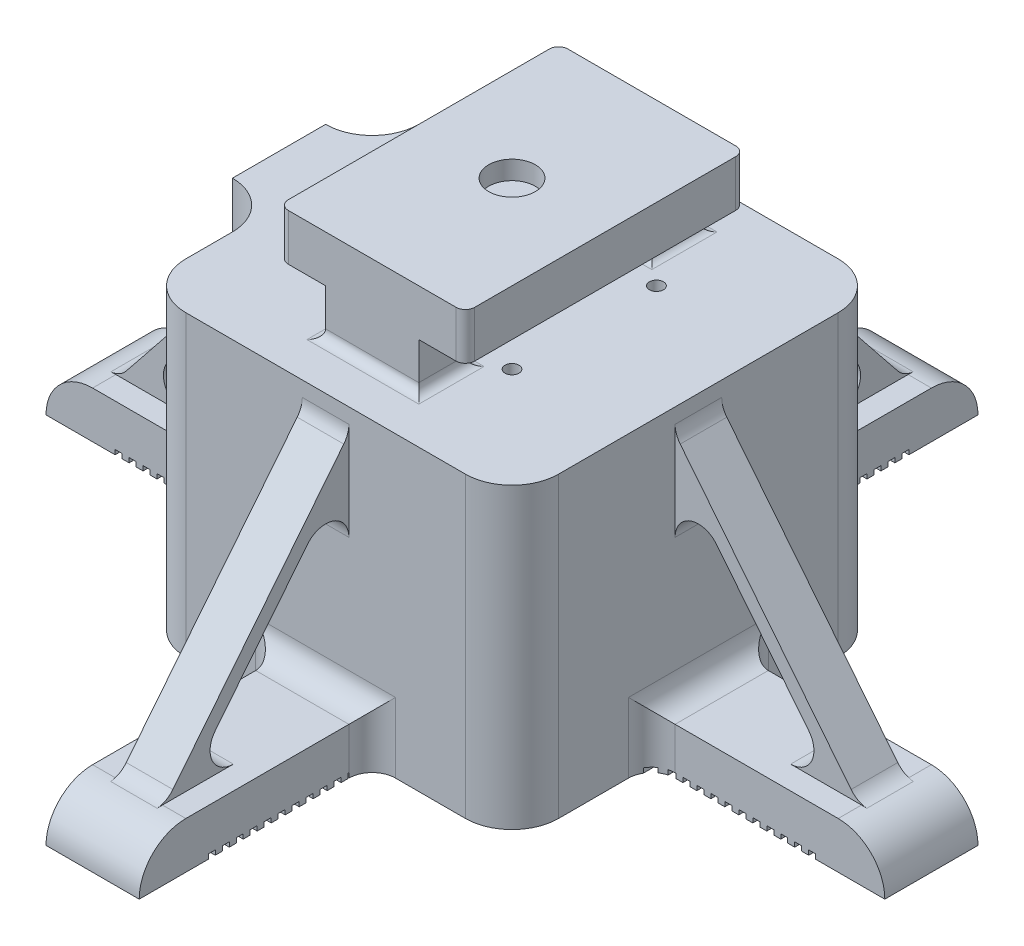
from build123d import *

# Parameters (mm, degrees)
SKETCH1_W                     = 80
SKETCH1_H                     = 80
BOSS_EXTRUDE1_DEPTH           = 14
SKETCH2_W                     = 80
SKETCH2_H                     = 80
SKETCH2_W_2                   = 70
SKETCH2_H_2                   = 70
BOSS_EXTRUDE2_DEPTH           = 50
SKETCH3_R                     = 1.5
CUT_EXTRUDE1_DEPTH            = 50
SKETCH4_R                     = 2.75
CUT_EXTRUDE2_DEPTH            = 50
SKETCH5_W                     = 20
SKETCH5_H                     = 10
BOSS_EXTRUDE3_DEPTH           = 50
SKETCH7_W                     = 45
SKETCH7_H                     = 10
CUT_EXTRUDE3_DEPTH            = 5
SKETCH8_W                     = 1.5
SKETCH8_H                     = 5
CUT_EXTRUDE4_DEPTH            = 1
LPATTERN1_COUNT               = 13
LPATTERN1_PITCH               = 3
LPATTERN1_COUNT_DIR2          = 2
LPATTERN1_PITCH_DIR2          = 15
CIRPATTERN10_COUNT            = 4
FILLET3_R                     = 5
CIRPATTERN11_COUNT            = 4
CIRPATTERN11_COPY_1_SKETCH_W  = 1.5
CIRPATTERN11_COPY_1_SKETCH_H  = 5
CIRPATTERN11_COPY_1_DEPTH     = 1
CIRPATTERN11_COPY_2_SKETCH_W  = 1.5
CIRPATTERN11_COPY_2_SKETCH_H  = 5
CIRPATTERN11_COPY_2_DEPTH     = 1
CIRPATTERN11_COPY_3_SKETCH_W  = 1.5
CIRPATTERN11_COPY_3_SKETCH_H  = 5
CIRPATTERN11_COPY_3_DEPTH     = 1
CIRPATTERN11_COPY_4_SKETCH_W  = 1.5
CIRPATTERN11_COPY_4_SKETCH_H  = 5
CIRPATTERN11_COPY_4_DEPTH     = 1
CIRPATTERN11_COPY_5_SKETCH_W  = 1.5
CIRPATTERN11_COPY_5_SKETCH_H  = 5
CIRPATTERN11_COPY_5_DEPTH     = 1
CIRPATTERN11_COPY_6_SKETCH_W  = 1.5
CIRPATTERN11_COPY_6_SKETCH_H  = 5
CIRPATTERN11_COPY_6_DEPTH     = 1
CIRPATTERN11_COPY_7_SKETCH_W  = 1.5
CIRPATTERN11_COPY_7_SKETCH_H  = 5
CIRPATTERN11_COPY_7_DEPTH     = 1
CIRPATTERN11_COPY_8_SKETCH_W  = 1.5
CIRPATTERN11_COPY_8_SKETCH_H  = 5
CIRPATTERN11_COPY_8_DEPTH     = 1
CIRPATTERN11_COPY_9_SKETCH_W  = 1.5
CIRPATTERN11_COPY_9_SKETCH_H  = 5
CIRPATTERN11_COPY_9_DEPTH     = 1
CIRPATTERN11_COPY_10_SKETCH_W = 1.5
CIRPATTERN11_COPY_10_SKETCH_H = 5
CIRPATTERN11_COPY_10_DEPTH    = 1
CIRPATTERN11_COPY_11_SKETCH_W = 1.5
CIRPATTERN11_COPY_11_SKETCH_H = 5
CIRPATTERN11_COPY_11_DEPTH    = 1
CIRPATTERN11_COPY_12_SKETCH_W = 1.5
CIRPATTERN11_COPY_12_SKETCH_H = 5
CIRPATTERN11_COPY_12_DEPTH    = 1
CIRPATTERN11_COPY_13_SKETCH_W = 1.5
CIRPATTERN11_COPY_13_SKETCH_H = 5
CIRPATTERN11_COPY_13_DEPTH    = 1
CIRPATTERN11_COPY_14_SKETCH_W = 1.5
CIRPATTERN11_COPY_14_SKETCH_H = 5
CIRPATTERN11_COPY_14_DEPTH    = 1
CIRPATTERN11_COPY_15_SKETCH_W = 1.5
CIRPATTERN11_COPY_15_SKETCH_H = 5
CIRPATTERN11_COPY_15_DEPTH    = 1
CIRPATTERN11_COPY_16_SKETCH_W = 1.5
CIRPATTERN11_COPY_16_SKETCH_H = 5
CIRPATTERN11_COPY_16_DEPTH    = 1
CIRPATTERN11_COPY_17_SKETCH_W = 1.5
CIRPATTERN11_COPY_17_SKETCH_H = 5
CIRPATTERN11_COPY_17_DEPTH    = 1
CIRPATTERN11_COPY_18_SKETCH_W = 1.5
CIRPATTERN11_COPY_18_SKETCH_H = 5
CIRPATTERN11_COPY_18_DEPTH    = 1
CIRPATTERN11_COPY_19_SKETCH_W = 1.5
CIRPATTERN11_COPY_19_SKETCH_H = 5
CIRPATTERN11_COPY_19_DEPTH    = 1
CIRPATTERN11_COPY_20_SKETCH_W = 1.5
CIRPATTERN11_COPY_20_SKETCH_H = 5
CIRPATTERN11_COPY_20_DEPTH    = 1
CIRPATTERN11_COPY_21_SKETCH_W = 1.5
CIRPATTERN11_COPY_21_SKETCH_H = 5
CIRPATTERN11_COPY_21_DEPTH    = 1
CIRPATTERN11_COPY_22_SKETCH_W = 1.5
CIRPATTERN11_COPY_22_SKETCH_H = 5
CIRPATTERN11_COPY_22_DEPTH    = 1
CIRPATTERN11_COPY_23_SKETCH_W = 1.5
CIRPATTERN11_COPY_23_SKETCH_H = 5
CIRPATTERN11_COPY_23_DEPTH    = 1
CIRPATTERN11_COPY_24_SKETCH_W = 1.5
CIRPATTERN11_COPY_24_SKETCH_H = 5
CIRPATTERN11_COPY_24_DEPTH    = 1
CIRPATTERN11_COPY_25_SKETCH_W = 1.5
CIRPATTERN11_COPY_25_SKETCH_H = 5
CIRPATTERN11_COPY_25_DEPTH    = 1
CIRPATTERN11_COPY_26_SKETCH_W = 1.5
CIRPATTERN11_COPY_26_SKETCH_H = 5
CIRPATTERN11_COPY_26_DEPTH    = 1
CIRPATTERN11_COPY_27_SKETCH_W = 1.5
CIRPATTERN11_COPY_27_SKETCH_H = 5
CIRPATTERN11_COPY_27_DEPTH    = 1
CIRPATTERN11_COPY_28_SKETCH_W = 1.5
CIRPATTERN11_COPY_28_SKETCH_H = 5
CIRPATTERN11_COPY_28_DEPTH    = 1
CIRPATTERN11_COPY_29_SKETCH_W = 1.5
CIRPATTERN11_COPY_29_SKETCH_H = 5
CIRPATTERN11_COPY_29_DEPTH    = 1
CIRPATTERN11_COPY_30_SKETCH_W = 1.5
CIRPATTERN11_COPY_30_SKETCH_H = 5
CIRPATTERN11_COPY_30_DEPTH    = 1
CIRPATTERN11_COPY_31_SKETCH_W = 1.5
CIRPATTERN11_COPY_31_SKETCH_H = 5
CIRPATTERN11_COPY_31_DEPTH    = 1
CIRPATTERN11_COPY_32_SKETCH_W = 1.5
CIRPATTERN11_COPY_32_SKETCH_H = 5
CIRPATTERN11_COPY_32_DEPTH    = 1
CIRPATTERN11_COPY_33_SKETCH_W = 1.5
CIRPATTERN11_COPY_33_SKETCH_H = 5
CIRPATTERN11_COPY_33_DEPTH    = 1
CIRPATTERN11_COPY_34_SKETCH_W = 1.5
CIRPATTERN11_COPY_34_SKETCH_H = 5
CIRPATTERN11_COPY_34_DEPTH    = 1
CIRPATTERN11_COPY_35_SKETCH_W = 1.5
CIRPATTERN11_COPY_35_SKETCH_H = 5
CIRPATTERN11_COPY_35_DEPTH    = 1
CIRPATTERN11_COPY_36_SKETCH_W = 1.5
CIRPATTERN11_COPY_36_SKETCH_H = 5
CIRPATTERN11_COPY_36_DEPTH    = 1
CIRPATTERN11_COPY_37_SKETCH_W = 1.5
CIRPATTERN11_COPY_37_SKETCH_H = 5
CIRPATTERN11_COPY_37_DEPTH    = 1
CIRPATTERN11_COPY_38_SKETCH_W = 1.5
CIRPATTERN11_COPY_38_SKETCH_H = 5
CIRPATTERN11_COPY_38_DEPTH    = 1
CIRPATTERN11_COPY_39_SKETCH_W = 1.5
CIRPATTERN11_COPY_39_SKETCH_H = 5
CIRPATTERN11_COPY_39_DEPTH    = 1
CIRPATTERN11_COPY_40_SKETCH_W = 1.5
CIRPATTERN11_COPY_40_SKETCH_H = 5
CIRPATTERN11_COPY_40_DEPTH    = 1
CIRPATTERN11_COPY_41_SKETCH_W = 1.5
CIRPATTERN11_COPY_41_SKETCH_H = 5
CIRPATTERN11_COPY_41_DEPTH    = 1
CIRPATTERN11_COPY_42_SKETCH_W = 1.5
CIRPATTERN11_COPY_42_SKETCH_H = 5
CIRPATTERN11_COPY_42_DEPTH    = 1
CIRPATTERN11_COPY_43_SKETCH_W = 1.5
CIRPATTERN11_COPY_43_SKETCH_H = 5
CIRPATTERN11_COPY_43_DEPTH    = 1
CIRPATTERN11_COPY_44_SKETCH_W = 1.5
CIRPATTERN11_COPY_44_SKETCH_H = 5
CIRPATTERN11_COPY_44_DEPTH    = 1
CIRPATTERN11_COPY_45_SKETCH_W = 1.5
CIRPATTERN11_COPY_45_SKETCH_H = 5
CIRPATTERN11_COPY_45_DEPTH    = 1
CIRPATTERN11_COPY_46_SKETCH_W = 1.5
CIRPATTERN11_COPY_46_SKETCH_H = 5
CIRPATTERN11_COPY_46_DEPTH    = 1
CIRPATTERN11_COPY_47_SKETCH_W = 1.5
CIRPATTERN11_COPY_47_SKETCH_H = 5
CIRPATTERN11_COPY_47_DEPTH    = 1
CIRPATTERN11_COPY_48_SKETCH_W = 1.5
CIRPATTERN11_COPY_48_SKETCH_H = 5
CIRPATTERN11_COPY_48_DEPTH    = 1
CIRPATTERN11_COPY_49_SKETCH_W = 1.5
CIRPATTERN11_COPY_49_SKETCH_H = 5
CIRPATTERN11_COPY_49_DEPTH    = 1
CIRPATTERN11_COPY_50_SKETCH_W = 1.5
CIRPATTERN11_COPY_50_SKETCH_H = 5
CIRPATTERN11_COPY_50_DEPTH    = 1
CIRPATTERN11_COPY_51_SKETCH_W = 1.5
CIRPATTERN11_COPY_51_SKETCH_H = 5
CIRPATTERN11_COPY_51_DEPTH    = 1
CIRPATTERN11_COPY_52_SKETCH_W = 1.5
CIRPATTERN11_COPY_52_SKETCH_H = 5
CIRPATTERN11_COPY_52_DEPTH    = 1
CIRPATTERN11_COPY_53_SKETCH_W = 1.5
CIRPATTERN11_COPY_53_SKETCH_H = 5
CIRPATTERN11_COPY_53_DEPTH    = 1
CIRPATTERN11_COPY_54_SKETCH_W = 1.5
CIRPATTERN11_COPY_54_SKETCH_H = 5
CIRPATTERN11_COPY_54_DEPTH    = 1
CIRPATTERN11_COPY_55_SKETCH_W = 1.5
CIRPATTERN11_COPY_55_SKETCH_H = 5
CIRPATTERN11_COPY_55_DEPTH    = 1
CIRPATTERN11_COPY_56_SKETCH_W = 1.5
CIRPATTERN11_COPY_56_SKETCH_H = 5
CIRPATTERN11_COPY_56_DEPTH    = 1
CIRPATTERN11_COPY_57_SKETCH_W = 1.5
CIRPATTERN11_COPY_57_SKETCH_H = 5
CIRPATTERN11_COPY_57_DEPTH    = 1
CIRPATTERN11_COPY_58_SKETCH_W = 1.5
CIRPATTERN11_COPY_58_SKETCH_H = 5
CIRPATTERN11_COPY_58_DEPTH    = 1
CIRPATTERN11_COPY_59_SKETCH_W = 1.5
CIRPATTERN11_COPY_59_SKETCH_H = 5
CIRPATTERN11_COPY_59_DEPTH    = 1
CIRPATTERN11_COPY_60_SKETCH_W = 1.5
CIRPATTERN11_COPY_60_SKETCH_H = 5
CIRPATTERN11_COPY_60_DEPTH    = 1
CIRPATTERN11_COPY_61_SKETCH_W = 1.5
CIRPATTERN11_COPY_61_SKETCH_H = 5
CIRPATTERN11_COPY_61_DEPTH    = 1
CIRPATTERN11_COPY_62_SKETCH_W = 1.5
CIRPATTERN11_COPY_62_SKETCH_H = 5
CIRPATTERN11_COPY_62_DEPTH    = 1
CIRPATTERN11_COPY_63_SKETCH_W = 1.5
CIRPATTERN11_COPY_63_SKETCH_H = 5
CIRPATTERN11_COPY_63_DEPTH    = 1
CIRPATTERN11_COPY_64_SKETCH_W = 1.5
CIRPATTERN11_COPY_64_SKETCH_H = 5
CIRPATTERN11_COPY_64_DEPTH    = 1
CIRPATTERN11_COPY_65_SKETCH_W = 1.5
CIRPATTERN11_COPY_65_SKETCH_H = 5
CIRPATTERN11_COPY_65_DEPTH    = 1
CIRPATTERN11_COPY_66_SKETCH_W = 1.5
CIRPATTERN11_COPY_66_SKETCH_H = 5
CIRPATTERN11_COPY_66_DEPTH    = 1
CIRPATTERN11_COPY_67_SKETCH_W = 1.5
CIRPATTERN11_COPY_67_SKETCH_H = 5
CIRPATTERN11_COPY_67_DEPTH    = 1
CIRPATTERN11_COPY_68_SKETCH_W = 1.5
CIRPATTERN11_COPY_68_SKETCH_H = 5
CIRPATTERN11_COPY_68_DEPTH    = 1
CIRPATTERN11_COPY_69_SKETCH_W = 1.5
CIRPATTERN11_COPY_69_SKETCH_H = 5
CIRPATTERN11_COPY_69_DEPTH    = 1
CIRPATTERN11_COPY_70_SKETCH_W = 1.5
CIRPATTERN11_COPY_70_SKETCH_H = 5
CIRPATTERN11_COPY_70_DEPTH    = 1
CIRPATTERN11_COPY_71_SKETCH_W = 1.5
CIRPATTERN11_COPY_71_SKETCH_H = 5
CIRPATTERN11_COPY_71_DEPTH    = 1
CIRPATTERN11_COPY_72_SKETCH_W = 1.5
CIRPATTERN11_COPY_72_SKETCH_H = 5
CIRPATTERN11_COPY_72_DEPTH    = 1
CIRPATTERN11_COPY_73_SKETCH_W = 1.5
CIRPATTERN11_COPY_73_SKETCH_H = 5
CIRPATTERN11_COPY_73_DEPTH    = 1
CIRPATTERN11_COPY_74_SKETCH_W = 1.5
CIRPATTERN11_COPY_74_SKETCH_H = 5
CIRPATTERN11_COPY_74_DEPTH    = 1
CIRPATTERN11_COPY_75_SKETCH_W = 1.5
CIRPATTERN11_COPY_75_SKETCH_H = 5
CIRPATTERN11_COPY_75_DEPTH    = 1
FILLET4_R                     = 10
FILLET5_R                     = 10
BOSS_EXTRUDE4_DEPTH           = 5
CIRPATTERN13_COUNT            = 4
FILLET7_R                     = 5
SKETCH11_W                    = 20
SKETCH11_H                    = 25
BOSS_EXTRUDE5_DEPTH           = 10
FILLET8_R                     = 10
SKETCH10_R                    = 2.25
CUT_EXTRUDE5_DEPTH            = 5
SKETCH12_W                    = 20
SKETCH12_H                    = 10
BOSS_EXTRUDE6_DEPTH           = 10
SKETCH13_W                    = 40
SKETCH13_H                    = 60
BOSS_EXTRUDE7_DEPTH           = 10
SKETCH14_R                    = 5
CUT_EXTRUDE6_DEPTH            = 4
FILLET9_R                     = 2


# Some blends are built 0.0001 mm under size
with BuildPart() as part:
    # Sketch1 → Boss-Extrude1 (new body)
    with BuildSketch(Plane(origin=(0, 0, 0), x_dir=(1, 0, 0), z_dir=(0, 1, 0))):
        Rectangle(SKETCH1_W, SKETCH1_H)
    extrude(amount=BOSS_EXTRUDE1_DEPTH)

    # Sketch2 → Boss-Extrude2 (add)
    with BuildSketch(Plane.XZ):
        Rectangle(SKETCH2_W, SKETCH2_H)
        Rectangle(SKETCH2_W_2, SKETCH2_H_2, mode=Mode.SUBTRACT)
    extrude(amount=BOSS_EXTRUDE2_DEPTH)

    # Sketch3 → Cut-Extrude1 (cut)
    with BuildSketch(Plane.XZ):
        with Locations(Location((-15.5, 15.5, 0), (0, 0, 270))):
            Circle(SKETCH3_R)
        with Locations(Location((15.5, 15.5, 0), (0, 0, 270))):
            Circle(SKETCH3_R)
        with Locations(Location((15.5, -15.5, 0), (0, 0, 270))):
            Circle(SKETCH3_R)
        with Locations(Location((-15.5, -15.5, 0), (0, 0, 270))):
            Circle(SKETCH3_R)
    extrude(amount=-CUT_EXTRUDE1_DEPTH, mode=Mode.SUBTRACT)

    # Sketch4 → Cut-Extrude2 (cut)
    with BuildSketch(Plane.XZ):
        with Locations(Location((0, 0, 0), (0, 0, 270))):
            Circle(SKETCH4_R)
    extrude(amount=-CUT_EXTRUDE2_DEPTH, mode=Mode.SUBTRACT)

    # Sketch5 → Boss-Extrude3 (add)
    with BuildSketch(Plane(origin=(40, 0, 0), x_dir=(0, 0, -1), z_dir=(1, 0, 0))):
        with Locations((0, -45)):
            Rectangle(SKETCH5_W, SKETCH5_H)
    boss_extrude3 = extrude(amount=BOSS_EXTRUDE3_DEPTH)

    # Sketch7 → Cut-Extrude3 (cut)
    with BuildSketch(Plane.XZ.offset(50)):
        with Locations((62.5, 0)):
            Rectangle(SKETCH7_W, SKETCH7_H)
    extrude(amount=-CUT_EXTRUDE3_DEPTH, mode=Mode.SUBTRACT)

    # Sketch8 → Cut-Extrude4 (cut)
    with BuildSketch(Plane.XZ.offset(50)):
        with Locations((38.422115652, 7.5)):
            Rectangle(SKETCH8_W, SKETCH8_H)
    cut_extrude4 = extrude(amount=-CUT_EXTRUDE4_DEPTH, mode=Mode.SUBTRACT)

    # LPattern1: Cut-Extrude4 13 × 2
    with Locations(*[(i * LPATTERN1_PITCH, 0, -j * LPATTERN1_PITCH_DIR2) for i in range(LPATTERN1_COUNT) for j in range(LPATTERN1_COUNT_DIR2) if (i, j) != (0, 0)]):
        add(cut_extrude4, mode=Mode.SUBTRACT)

    # CirPattern10: Boss-Extrude3 ×4 about axis
    cirpattern10_axis = Axis((0, 0, 0), (0, 1, 0))
    for i in range(1, CIRPATTERN10_COUNT):
        add(boss_extrude3.rotate(cirpattern10_axis, i * 360 / CIRPATTERN10_COUNT))

    # Fillet3
    fillet3_edges = [part.edges().sort_by_distance(p)[0] for p in [
        (-10, -45, 40),
        (-40, -45, 10),
        (-40, -40, 0),
        (-40, -45, -10),
        (-10, -45, -40),
        (0, -40, -40),
        (10, -45, -40),
        (40, -45, -10),
        (40, -40, 0),
        (0, -40, 40),
        (40, -45, 10),
        (10, -45, 40),
    ]]
    fillet(fillet3_edges, radius=FILLET3_R)

    # CirPattern11: Cut-Extrude4 ×4 about axis
    cirpattern11_axis = Axis((0, 0, 0), (0, 1, 0))
    for i in range(1, CIRPATTERN11_COUNT):
        add(cut_extrude4.rotate(cirpattern11_axis, i * 360 / CIRPATTERN11_COUNT), mode=Mode.SUBTRACT)

    # CirPattern11 copy 1 sketch → CirPattern11 copy 1 (cut)
    with BuildSketch(Plane(origin=(-15, -50, 0), x_dir=(0, 0, -1), z_dir=(0, -1, 0))):
        with Locations((38.422115652, 7.5)):
            Rectangle(CIRPATTERN11_COPY_1_SKETCH_W, CIRPATTERN11_COPY_1_SKETCH_H)
    extrude(amount=-CIRPATTERN11_COPY_1_DEPTH, mode=Mode.SUBTRACT)

    # CirPattern11 copy 2 sketch → CirPattern11 copy 2 (cut)
    with BuildSketch(Plane(origin=(0, -50, 15), x_dir=(-1, 0, 0), z_dir=(0, -1, 0))):
        with Locations((38.422115652, 7.5)):
            Rectangle(CIRPATTERN11_COPY_2_SKETCH_W, CIRPATTERN11_COPY_2_SKETCH_H)
    extrude(amount=-CIRPATTERN11_COPY_2_DEPTH, mode=Mode.SUBTRACT)

    # CirPattern11 copy 3 sketch → CirPattern11 copy 3 (cut)
    with BuildSketch(Plane(origin=(15, -50, 0), x_dir=(0, 0, 1), z_dir=(0, -1, 0))):
        with Locations((38.422115652, 7.5)):
            Rectangle(CIRPATTERN11_COPY_3_SKETCH_W, CIRPATTERN11_COPY_3_SKETCH_H)
    extrude(amount=-CIRPATTERN11_COPY_3_DEPTH, mode=Mode.SUBTRACT)

    # CirPattern11 copy 4 sketch → CirPattern11 copy 4 (cut)
    with BuildSketch(Plane(origin=(0, -50, -3), x_dir=(0, 0, -1), z_dir=(0, -1, 0))):
        with Locations((38.422115652, 7.5)):
            Rectangle(CIRPATTERN11_COPY_4_SKETCH_W, CIRPATTERN11_COPY_4_SKETCH_H)
    extrude(amount=-CIRPATTERN11_COPY_4_DEPTH, mode=Mode.SUBTRACT)

    # CirPattern11 copy 5 sketch → CirPattern11 copy 5 (cut)
    with BuildSketch(Plane(origin=(-3, -50, 0), x_dir=(-1, 0, 0), z_dir=(0, -1, 0))):
        with Locations((38.422115652, 7.5)):
            Rectangle(CIRPATTERN11_COPY_5_SKETCH_W, CIRPATTERN11_COPY_5_SKETCH_H)
    extrude(amount=-CIRPATTERN11_COPY_5_DEPTH, mode=Mode.SUBTRACT)

    # CirPattern11 copy 6 sketch → CirPattern11 copy 6 (cut)
    with BuildSketch(Plane(origin=(0, -50, 3), x_dir=(0, 0, 1), z_dir=(0, -1, 0))):
        with Locations((38.422115652, 7.5)):
            Rectangle(CIRPATTERN11_COPY_6_SKETCH_W, CIRPATTERN11_COPY_6_SKETCH_H)
    extrude(amount=-CIRPATTERN11_COPY_6_DEPTH, mode=Mode.SUBTRACT)

    # CirPattern11 copy 7 sketch → CirPattern11 copy 7 (cut)
    with BuildSketch(Plane(origin=(-15, -50, -3), x_dir=(0, 0, -1), z_dir=(0, -1, 0))):
        with Locations((38.422115652, 7.5)):
            Rectangle(CIRPATTERN11_COPY_7_SKETCH_W, CIRPATTERN11_COPY_7_SKETCH_H)
    extrude(amount=-CIRPATTERN11_COPY_7_DEPTH, mode=Mode.SUBTRACT)

    # CirPattern11 copy 8 sketch → CirPattern11 copy 8 (cut)
    with BuildSketch(Plane(origin=(-3, -50, 15), x_dir=(-1, 0, 0), z_dir=(0, -1, 0))):
        with Locations((38.422115652, 7.5)):
            Rectangle(CIRPATTERN11_COPY_8_SKETCH_W, CIRPATTERN11_COPY_8_SKETCH_H)
    extrude(amount=-CIRPATTERN11_COPY_8_DEPTH, mode=Mode.SUBTRACT)

    # CirPattern11 copy 9 sketch → CirPattern11 copy 9 (cut)
    with BuildSketch(Plane(origin=(15, -50, 3), x_dir=(0, 0, 1), z_dir=(0, -1, 0))):
        with Locations((38.422115652, 7.5)):
            Rectangle(CIRPATTERN11_COPY_9_SKETCH_W, CIRPATTERN11_COPY_9_SKETCH_H)
    extrude(amount=-CIRPATTERN11_COPY_9_DEPTH, mode=Mode.SUBTRACT)

    # CirPattern11 copy 10 sketch → CirPattern11 copy 10 (cut)
    with BuildSketch(Plane(origin=(0, -50, -6), x_dir=(0, 0, -1), z_dir=(0, -1, 0))):
        with Locations((38.422115652, 7.5)):
            Rectangle(CIRPATTERN11_COPY_10_SKETCH_W, CIRPATTERN11_COPY_10_SKETCH_H)
    extrude(amount=-CIRPATTERN11_COPY_10_DEPTH, mode=Mode.SUBTRACT)

    # CirPattern11 copy 11 sketch → CirPattern11 copy 11 (cut)
    with BuildSketch(Plane(origin=(-6, -50, 0), x_dir=(-1, 0, 0), z_dir=(0, -1, 0))):
        with Locations((38.422115652, 7.5)):
            Rectangle(CIRPATTERN11_COPY_11_SKETCH_W, CIRPATTERN11_COPY_11_SKETCH_H)
    extrude(amount=-CIRPATTERN11_COPY_11_DEPTH, mode=Mode.SUBTRACT)

    # CirPattern11 copy 12 sketch → CirPattern11 copy 12 (cut)
    with BuildSketch(Plane(origin=(0, -50, 6), x_dir=(0, 0, 1), z_dir=(0, -1, 0))):
        with Locations((38.422115652, 7.5)):
            Rectangle(CIRPATTERN11_COPY_12_SKETCH_W, CIRPATTERN11_COPY_12_SKETCH_H)
    extrude(amount=-CIRPATTERN11_COPY_12_DEPTH, mode=Mode.SUBTRACT)

    # CirPattern11 copy 13 sketch → CirPattern11 copy 13 (cut)
    with BuildSketch(Plane(origin=(-15, -50, -6), x_dir=(0, 0, -1), z_dir=(0, -1, 0))):
        with Locations((38.422115652, 7.5)):
            Rectangle(CIRPATTERN11_COPY_13_SKETCH_W, CIRPATTERN11_COPY_13_SKETCH_H)
    extrude(amount=-CIRPATTERN11_COPY_13_DEPTH, mode=Mode.SUBTRACT)

    # CirPattern11 copy 14 sketch → CirPattern11 copy 14 (cut)
    with BuildSketch(Plane(origin=(-6, -50, 15), x_dir=(-1, 0, 0), z_dir=(0, -1, 0))):
        with Locations((38.422115652, 7.5)):
            Rectangle(CIRPATTERN11_COPY_14_SKETCH_W, CIRPATTERN11_COPY_14_SKETCH_H)
    extrude(amount=-CIRPATTERN11_COPY_14_DEPTH, mode=Mode.SUBTRACT)

    # CirPattern11 copy 15 sketch → CirPattern11 copy 15 (cut)
    with BuildSketch(Plane(origin=(15, -50, 6), x_dir=(0, 0, 1), z_dir=(0, -1, 0))):
        with Locations((38.422115652, 7.5)):
            Rectangle(CIRPATTERN11_COPY_15_SKETCH_W, CIRPATTERN11_COPY_15_SKETCH_H)
    extrude(amount=-CIRPATTERN11_COPY_15_DEPTH, mode=Mode.SUBTRACT)

    # CirPattern11 copy 16 sketch → CirPattern11 copy 16 (cut)
    with BuildSketch(Plane(origin=(0, -50, -9), x_dir=(0, 0, -1), z_dir=(0, -1, 0))):
        with Locations((38.422115652, 7.5)):
            Rectangle(CIRPATTERN11_COPY_16_SKETCH_W, CIRPATTERN11_COPY_16_SKETCH_H)
    extrude(amount=-CIRPATTERN11_COPY_16_DEPTH, mode=Mode.SUBTRACT)

    # CirPattern11 copy 17 sketch → CirPattern11 copy 17 (cut)
    with BuildSketch(Plane(origin=(-9, -50, 0), x_dir=(-1, 0, 0), z_dir=(0, -1, 0))):
        with Locations((38.422115652, 7.5)):
            Rectangle(CIRPATTERN11_COPY_17_SKETCH_W, CIRPATTERN11_COPY_17_SKETCH_H)
    extrude(amount=-CIRPATTERN11_COPY_17_DEPTH, mode=Mode.SUBTRACT)

    # CirPattern11 copy 18 sketch → CirPattern11 copy 18 (cut)
    with BuildSketch(Plane(origin=(0, -50, 9), x_dir=(0, 0, 1), z_dir=(0, -1, 0))):
        with Locations((38.422115652, 7.5)):
            Rectangle(CIRPATTERN11_COPY_18_SKETCH_W, CIRPATTERN11_COPY_18_SKETCH_H)
    extrude(amount=-CIRPATTERN11_COPY_18_DEPTH, mode=Mode.SUBTRACT)

    # CirPattern11 copy 19 sketch → CirPattern11 copy 19 (cut)
    with BuildSketch(Plane(origin=(-15, -50, -9), x_dir=(0, 0, -1), z_dir=(0, -1, 0))):
        with Locations((38.422115652, 7.5)):
            Rectangle(CIRPATTERN11_COPY_19_SKETCH_W, CIRPATTERN11_COPY_19_SKETCH_H)
    extrude(amount=-CIRPATTERN11_COPY_19_DEPTH, mode=Mode.SUBTRACT)

    # CirPattern11 copy 20 sketch → CirPattern11 copy 20 (cut)
    with BuildSketch(Plane(origin=(-9, -50, 15), x_dir=(-1, 0, 0), z_dir=(0, -1, 0))):
        with Locations((38.422115652, 7.5)):
            Rectangle(CIRPATTERN11_COPY_20_SKETCH_W, CIRPATTERN11_COPY_20_SKETCH_H)
    extrude(amount=-CIRPATTERN11_COPY_20_DEPTH, mode=Mode.SUBTRACT)

    # CirPattern11 copy 21 sketch → CirPattern11 copy 21 (cut)
    with BuildSketch(Plane(origin=(15, -50, 9), x_dir=(0, 0, 1), z_dir=(0, -1, 0))):
        with Locations((38.422115652, 7.5)):
            Rectangle(CIRPATTERN11_COPY_21_SKETCH_W, CIRPATTERN11_COPY_21_SKETCH_H)
    extrude(amount=-CIRPATTERN11_COPY_21_DEPTH, mode=Mode.SUBTRACT)

    # CirPattern11 copy 22 sketch → CirPattern11 copy 22 (cut)
    with BuildSketch(Plane(origin=(0, -50, -12), x_dir=(0, 0, -1), z_dir=(0, -1, 0))):
        with Locations((38.422115652, 7.5)):
            Rectangle(CIRPATTERN11_COPY_22_SKETCH_W, CIRPATTERN11_COPY_22_SKETCH_H)
    extrude(amount=-CIRPATTERN11_COPY_22_DEPTH, mode=Mode.SUBTRACT)

    # CirPattern11 copy 23 sketch → CirPattern11 copy 23 (cut)
    with BuildSketch(Plane(origin=(-12, -50, 0), x_dir=(-1, 0, 0), z_dir=(0, -1, 0))):
        with Locations((38.422115652, 7.5)):
            Rectangle(CIRPATTERN11_COPY_23_SKETCH_W, CIRPATTERN11_COPY_23_SKETCH_H)
    extrude(amount=-CIRPATTERN11_COPY_23_DEPTH, mode=Mode.SUBTRACT)

    # CirPattern11 copy 24 sketch → CirPattern11 copy 24 (cut)
    with BuildSketch(Plane(origin=(0, -50, 12), x_dir=(0, 0, 1), z_dir=(0, -1, 0))):
        with Locations((38.422115652, 7.5)):
            Rectangle(CIRPATTERN11_COPY_24_SKETCH_W, CIRPATTERN11_COPY_24_SKETCH_H)
    extrude(amount=-CIRPATTERN11_COPY_24_DEPTH, mode=Mode.SUBTRACT)

    # CirPattern11 copy 25 sketch → CirPattern11 copy 25 (cut)
    with BuildSketch(Plane(origin=(-15, -50, -12), x_dir=(0, 0, -1), z_dir=(0, -1, 0))):
        with Locations((38.422115652, 7.5)):
            Rectangle(CIRPATTERN11_COPY_25_SKETCH_W, CIRPATTERN11_COPY_25_SKETCH_H)
    extrude(amount=-CIRPATTERN11_COPY_25_DEPTH, mode=Mode.SUBTRACT)

    # CirPattern11 copy 26 sketch → CirPattern11 copy 26 (cut)
    with BuildSketch(Plane(origin=(-12, -50, 15), x_dir=(-1, 0, 0), z_dir=(0, -1, 0))):
        with Locations((38.422115652, 7.5)):
            Rectangle(CIRPATTERN11_COPY_26_SKETCH_W, CIRPATTERN11_COPY_26_SKETCH_H)
    extrude(amount=-CIRPATTERN11_COPY_26_DEPTH, mode=Mode.SUBTRACT)

    # CirPattern11 copy 27 sketch → CirPattern11 copy 27 (cut)
    with BuildSketch(Plane(origin=(15, -50, 12), x_dir=(0, 0, 1), z_dir=(0, -1, 0))):
        with Locations((38.422115652, 7.5)):
            Rectangle(CIRPATTERN11_COPY_27_SKETCH_W, CIRPATTERN11_COPY_27_SKETCH_H)
    extrude(amount=-CIRPATTERN11_COPY_27_DEPTH, mode=Mode.SUBTRACT)

    # CirPattern11 copy 28 sketch → CirPattern11 copy 28 (cut)
    with BuildSketch(Plane(origin=(0, -50, -15), x_dir=(0, 0, -1), z_dir=(0, -1, 0))):
        with Locations((38.422115652, 7.5)):
            Rectangle(CIRPATTERN11_COPY_28_SKETCH_W, CIRPATTERN11_COPY_28_SKETCH_H)
    extrude(amount=-CIRPATTERN11_COPY_28_DEPTH, mode=Mode.SUBTRACT)

    # CirPattern11 copy 29 sketch → CirPattern11 copy 29 (cut)
    with BuildSketch(Plane(origin=(-15, -50, 0), x_dir=(-1, 0, 0), z_dir=(0, -1, 0))):
        with Locations((38.422115652, 7.5)):
            Rectangle(CIRPATTERN11_COPY_29_SKETCH_W, CIRPATTERN11_COPY_29_SKETCH_H)
    extrude(amount=-CIRPATTERN11_COPY_29_DEPTH, mode=Mode.SUBTRACT)

    # CirPattern11 copy 30 sketch → CirPattern11 copy 30 (cut)
    with BuildSketch(Plane(origin=(0, -50, 15), x_dir=(0, 0, 1), z_dir=(0, -1, 0))):
        with Locations((38.422115652, 7.5)):
            Rectangle(CIRPATTERN11_COPY_30_SKETCH_W, CIRPATTERN11_COPY_30_SKETCH_H)
    extrude(amount=-CIRPATTERN11_COPY_30_DEPTH, mode=Mode.SUBTRACT)

    # CirPattern11 copy 31 sketch → CirPattern11 copy 31 (cut)
    with BuildSketch(Plane(origin=(-15, -50, -15), x_dir=(0, 0, -1), z_dir=(0, -1, 0))):
        with Locations((38.422115652, 7.5)):
            Rectangle(CIRPATTERN11_COPY_31_SKETCH_W, CIRPATTERN11_COPY_31_SKETCH_H)
    extrude(amount=-CIRPATTERN11_COPY_31_DEPTH, mode=Mode.SUBTRACT)

    # CirPattern11 copy 32 sketch → CirPattern11 copy 32 (cut)
    with BuildSketch(Plane(origin=(-15, -50, 15), x_dir=(-1, 0, 0), z_dir=(0, -1, 0))):
        with Locations((38.422115652, 7.5)):
            Rectangle(CIRPATTERN11_COPY_32_SKETCH_W, CIRPATTERN11_COPY_32_SKETCH_H)
    extrude(amount=-CIRPATTERN11_COPY_32_DEPTH, mode=Mode.SUBTRACT)

    # CirPattern11 copy 33 sketch → CirPattern11 copy 33 (cut)
    with BuildSketch(Plane(origin=(15, -50, 15), x_dir=(0, 0, 1), z_dir=(0, -1, 0))):
        with Locations((38.422115652, 7.5)):
            Rectangle(CIRPATTERN11_COPY_33_SKETCH_W, CIRPATTERN11_COPY_33_SKETCH_H)
    extrude(amount=-CIRPATTERN11_COPY_33_DEPTH, mode=Mode.SUBTRACT)

    # CirPattern11 copy 34 sketch → CirPattern11 copy 34 (cut)
    with BuildSketch(Plane(origin=(0, -50, -18), x_dir=(0, 0, -1), z_dir=(0, -1, 0))):
        with Locations((38.422115652, 7.5)):
            Rectangle(CIRPATTERN11_COPY_34_SKETCH_W, CIRPATTERN11_COPY_34_SKETCH_H)
    extrude(amount=-CIRPATTERN11_COPY_34_DEPTH, mode=Mode.SUBTRACT)

    # CirPattern11 copy 35 sketch → CirPattern11 copy 35 (cut)
    with BuildSketch(Plane(origin=(-18, -50, 0), x_dir=(-1, 0, 0), z_dir=(0, -1, 0))):
        with Locations((38.422115652, 7.5)):
            Rectangle(CIRPATTERN11_COPY_35_SKETCH_W, CIRPATTERN11_COPY_35_SKETCH_H)
    extrude(amount=-CIRPATTERN11_COPY_35_DEPTH, mode=Mode.SUBTRACT)

    # CirPattern11 copy 36 sketch → CirPattern11 copy 36 (cut)
    with BuildSketch(Plane(origin=(0, -50, 18), x_dir=(0, 0, 1), z_dir=(0, -1, 0))):
        with Locations((38.422115652, 7.5)):
            Rectangle(CIRPATTERN11_COPY_36_SKETCH_W, CIRPATTERN11_COPY_36_SKETCH_H)
    extrude(amount=-CIRPATTERN11_COPY_36_DEPTH, mode=Mode.SUBTRACT)

    # CirPattern11 copy 37 sketch → CirPattern11 copy 37 (cut)
    with BuildSketch(Plane(origin=(-15, -50, -18), x_dir=(0, 0, -1), z_dir=(0, -1, 0))):
        with Locations((38.422115652, 7.5)):
            Rectangle(CIRPATTERN11_COPY_37_SKETCH_W, CIRPATTERN11_COPY_37_SKETCH_H)
    extrude(amount=-CIRPATTERN11_COPY_37_DEPTH, mode=Mode.SUBTRACT)

    # CirPattern11 copy 38 sketch → CirPattern11 copy 38 (cut)
    with BuildSketch(Plane(origin=(-18, -50, 15), x_dir=(-1, 0, 0), z_dir=(0, -1, 0))):
        with Locations((38.422115652, 7.5)):
            Rectangle(CIRPATTERN11_COPY_38_SKETCH_W, CIRPATTERN11_COPY_38_SKETCH_H)
    extrude(amount=-CIRPATTERN11_COPY_38_DEPTH, mode=Mode.SUBTRACT)

    # CirPattern11 copy 39 sketch → CirPattern11 copy 39 (cut)
    with BuildSketch(Plane(origin=(15, -50, 18), x_dir=(0, 0, 1), z_dir=(0, -1, 0))):
        with Locations((38.422115652, 7.5)):
            Rectangle(CIRPATTERN11_COPY_39_SKETCH_W, CIRPATTERN11_COPY_39_SKETCH_H)
    extrude(amount=-CIRPATTERN11_COPY_39_DEPTH, mode=Mode.SUBTRACT)

    # CirPattern11 copy 40 sketch → CirPattern11 copy 40 (cut)
    with BuildSketch(Plane(origin=(0, -50, -21), x_dir=(0, 0, -1), z_dir=(0, -1, 0))):
        with Locations((38.422115652, 7.5)):
            Rectangle(CIRPATTERN11_COPY_40_SKETCH_W, CIRPATTERN11_COPY_40_SKETCH_H)
    extrude(amount=-CIRPATTERN11_COPY_40_DEPTH, mode=Mode.SUBTRACT)

    # CirPattern11 copy 41 sketch → CirPattern11 copy 41 (cut)
    with BuildSketch(Plane(origin=(-21, -50, 0), x_dir=(-1, 0, 0), z_dir=(0, -1, 0))):
        with Locations((38.422115652, 7.5)):
            Rectangle(CIRPATTERN11_COPY_41_SKETCH_W, CIRPATTERN11_COPY_41_SKETCH_H)
    extrude(amount=-CIRPATTERN11_COPY_41_DEPTH, mode=Mode.SUBTRACT)

    # CirPattern11 copy 42 sketch → CirPattern11 copy 42 (cut)
    with BuildSketch(Plane(origin=(0, -50, 21), x_dir=(0, 0, 1), z_dir=(0, -1, 0))):
        with Locations((38.422115652, 7.5)):
            Rectangle(CIRPATTERN11_COPY_42_SKETCH_W, CIRPATTERN11_COPY_42_SKETCH_H)
    extrude(amount=-CIRPATTERN11_COPY_42_DEPTH, mode=Mode.SUBTRACT)

    # CirPattern11 copy 43 sketch → CirPattern11 copy 43 (cut)
    with BuildSketch(Plane(origin=(-15, -50, -21), x_dir=(0, 0, -1), z_dir=(0, -1, 0))):
        with Locations((38.422115652, 7.5)):
            Rectangle(CIRPATTERN11_COPY_43_SKETCH_W, CIRPATTERN11_COPY_43_SKETCH_H)
    extrude(amount=-CIRPATTERN11_COPY_43_DEPTH, mode=Mode.SUBTRACT)

    # CirPattern11 copy 44 sketch → CirPattern11 copy 44 (cut)
    with BuildSketch(Plane(origin=(-21, -50, 15), x_dir=(-1, 0, 0), z_dir=(0, -1, 0))):
        with Locations((38.422115652, 7.5)):
            Rectangle(CIRPATTERN11_COPY_44_SKETCH_W, CIRPATTERN11_COPY_44_SKETCH_H)
    extrude(amount=-CIRPATTERN11_COPY_44_DEPTH, mode=Mode.SUBTRACT)

    # CirPattern11 copy 45 sketch → CirPattern11 copy 45 (cut)
    with BuildSketch(Plane(origin=(15, -50, 21), x_dir=(0, 0, 1), z_dir=(0, -1, 0))):
        with Locations((38.422115652, 7.5)):
            Rectangle(CIRPATTERN11_COPY_45_SKETCH_W, CIRPATTERN11_COPY_45_SKETCH_H)
    extrude(amount=-CIRPATTERN11_COPY_45_DEPTH, mode=Mode.SUBTRACT)

    # CirPattern11 copy 46 sketch → CirPattern11 copy 46 (cut)
    with BuildSketch(Plane(origin=(0, -50, -24), x_dir=(0, 0, -1), z_dir=(0, -1, 0))):
        with Locations((38.422115652, 7.5)):
            Rectangle(CIRPATTERN11_COPY_46_SKETCH_W, CIRPATTERN11_COPY_46_SKETCH_H)
    extrude(amount=-CIRPATTERN11_COPY_46_DEPTH, mode=Mode.SUBTRACT)

    # CirPattern11 copy 47 sketch → CirPattern11 copy 47 (cut)
    with BuildSketch(Plane(origin=(-24, -50, 0), x_dir=(-1, 0, 0), z_dir=(0, -1, 0))):
        with Locations((38.422115652, 7.5)):
            Rectangle(CIRPATTERN11_COPY_47_SKETCH_W, CIRPATTERN11_COPY_47_SKETCH_H)
    extrude(amount=-CIRPATTERN11_COPY_47_DEPTH, mode=Mode.SUBTRACT)

    # CirPattern11 copy 48 sketch → CirPattern11 copy 48 (cut)
    with BuildSketch(Plane(origin=(0, -50, 24), x_dir=(0, 0, 1), z_dir=(0, -1, 0))):
        with Locations((38.422115652, 7.5)):
            Rectangle(CIRPATTERN11_COPY_48_SKETCH_W, CIRPATTERN11_COPY_48_SKETCH_H)
    extrude(amount=-CIRPATTERN11_COPY_48_DEPTH, mode=Mode.SUBTRACT)

    # CirPattern11 copy 49 sketch → CirPattern11 copy 49 (cut)
    with BuildSketch(Plane(origin=(-15, -50, -24), x_dir=(0, 0, -1), z_dir=(0, -1, 0))):
        with Locations((38.422115652, 7.5)):
            Rectangle(CIRPATTERN11_COPY_49_SKETCH_W, CIRPATTERN11_COPY_49_SKETCH_H)
    extrude(amount=-CIRPATTERN11_COPY_49_DEPTH, mode=Mode.SUBTRACT)

    # CirPattern11 copy 50 sketch → CirPattern11 copy 50 (cut)
    with BuildSketch(Plane(origin=(-24, -50, 15), x_dir=(-1, 0, 0), z_dir=(0, -1, 0))):
        with Locations((38.422115652, 7.5)):
            Rectangle(CIRPATTERN11_COPY_50_SKETCH_W, CIRPATTERN11_COPY_50_SKETCH_H)
    extrude(amount=-CIRPATTERN11_COPY_50_DEPTH, mode=Mode.SUBTRACT)

    # CirPattern11 copy 51 sketch → CirPattern11 copy 51 (cut)
    with BuildSketch(Plane(origin=(15, -50, 24), x_dir=(0, 0, 1), z_dir=(0, -1, 0))):
        with Locations((38.422115652, 7.5)):
            Rectangle(CIRPATTERN11_COPY_51_SKETCH_W, CIRPATTERN11_COPY_51_SKETCH_H)
    extrude(amount=-CIRPATTERN11_COPY_51_DEPTH, mode=Mode.SUBTRACT)

    # CirPattern11 copy 52 sketch → CirPattern11 copy 52 (cut)
    with BuildSketch(Plane(origin=(0, -50, -27), x_dir=(0, 0, -1), z_dir=(0, -1, 0))):
        with Locations((38.422115652, 7.5)):
            Rectangle(CIRPATTERN11_COPY_52_SKETCH_W, CIRPATTERN11_COPY_52_SKETCH_H)
    extrude(amount=-CIRPATTERN11_COPY_52_DEPTH, mode=Mode.SUBTRACT)

    # CirPattern11 copy 53 sketch → CirPattern11 copy 53 (cut)
    with BuildSketch(Plane(origin=(-27, -50, 0), x_dir=(-1, 0, 0), z_dir=(0, -1, 0))):
        with Locations((38.422115652, 7.5)):
            Rectangle(CIRPATTERN11_COPY_53_SKETCH_W, CIRPATTERN11_COPY_53_SKETCH_H)
    extrude(amount=-CIRPATTERN11_COPY_53_DEPTH, mode=Mode.SUBTRACT)

    # CirPattern11 copy 54 sketch → CirPattern11 copy 54 (cut)
    with BuildSketch(Plane(origin=(0, -50, 27), x_dir=(0, 0, 1), z_dir=(0, -1, 0))):
        with Locations((38.422115652, 7.5)):
            Rectangle(CIRPATTERN11_COPY_54_SKETCH_W, CIRPATTERN11_COPY_54_SKETCH_H)
    extrude(amount=-CIRPATTERN11_COPY_54_DEPTH, mode=Mode.SUBTRACT)

    # CirPattern11 copy 55 sketch → CirPattern11 copy 55 (cut)
    with BuildSketch(Plane(origin=(-15, -50, -27), x_dir=(0, 0, -1), z_dir=(0, -1, 0))):
        with Locations((38.422115652, 7.5)):
            Rectangle(CIRPATTERN11_COPY_55_SKETCH_W, CIRPATTERN11_COPY_55_SKETCH_H)
    extrude(amount=-CIRPATTERN11_COPY_55_DEPTH, mode=Mode.SUBTRACT)

    # CirPattern11 copy 56 sketch → CirPattern11 copy 56 (cut)
    with BuildSketch(Plane(origin=(-27, -50, 15), x_dir=(-1, 0, 0), z_dir=(0, -1, 0))):
        with Locations((38.422115652, 7.5)):
            Rectangle(CIRPATTERN11_COPY_56_SKETCH_W, CIRPATTERN11_COPY_56_SKETCH_H)
    extrude(amount=-CIRPATTERN11_COPY_56_DEPTH, mode=Mode.SUBTRACT)

    # CirPattern11 copy 57 sketch → CirPattern11 copy 57 (cut)
    with BuildSketch(Plane(origin=(15, -50, 27), x_dir=(0, 0, 1), z_dir=(0, -1, 0))):
        with Locations((38.422115652, 7.5)):
            Rectangle(CIRPATTERN11_COPY_57_SKETCH_W, CIRPATTERN11_COPY_57_SKETCH_H)
    extrude(amount=-CIRPATTERN11_COPY_57_DEPTH, mode=Mode.SUBTRACT)

    # CirPattern11 copy 58 sketch → CirPattern11 copy 58 (cut)
    with BuildSketch(Plane(origin=(0, -50, -30), x_dir=(0, 0, -1), z_dir=(0, -1, 0))):
        with Locations((38.422115652, 7.5)):
            Rectangle(CIRPATTERN11_COPY_58_SKETCH_W, CIRPATTERN11_COPY_58_SKETCH_H)
    extrude(amount=-CIRPATTERN11_COPY_58_DEPTH, mode=Mode.SUBTRACT)

    # CirPattern11 copy 59 sketch → CirPattern11 copy 59 (cut)
    with BuildSketch(Plane(origin=(-30, -50, 0), x_dir=(-1, 0, 0), z_dir=(0, -1, 0))):
        with Locations((38.422115652, 7.5)):
            Rectangle(CIRPATTERN11_COPY_59_SKETCH_W, CIRPATTERN11_COPY_59_SKETCH_H)
    extrude(amount=-CIRPATTERN11_COPY_59_DEPTH, mode=Mode.SUBTRACT)

    # CirPattern11 copy 60 sketch → CirPattern11 copy 60 (cut)
    with BuildSketch(Plane(origin=(0, -50, 30), x_dir=(0, 0, 1), z_dir=(0, -1, 0))):
        with Locations((38.422115652, 7.5)):
            Rectangle(CIRPATTERN11_COPY_60_SKETCH_W, CIRPATTERN11_COPY_60_SKETCH_H)
    extrude(amount=-CIRPATTERN11_COPY_60_DEPTH, mode=Mode.SUBTRACT)

    # CirPattern11 copy 61 sketch → CirPattern11 copy 61 (cut)
    with BuildSketch(Plane(origin=(-15, -50, -30), x_dir=(0, 0, -1), z_dir=(0, -1, 0))):
        with Locations((38.422115652, 7.5)):
            Rectangle(CIRPATTERN11_COPY_61_SKETCH_W, CIRPATTERN11_COPY_61_SKETCH_H)
    extrude(amount=-CIRPATTERN11_COPY_61_DEPTH, mode=Mode.SUBTRACT)

    # CirPattern11 copy 62 sketch → CirPattern11 copy 62 (cut)
    with BuildSketch(Plane(origin=(-30, -50, 15), x_dir=(-1, 0, 0), z_dir=(0, -1, 0))):
        with Locations((38.422115652, 7.5)):
            Rectangle(CIRPATTERN11_COPY_62_SKETCH_W, CIRPATTERN11_COPY_62_SKETCH_H)
    extrude(amount=-CIRPATTERN11_COPY_62_DEPTH, mode=Mode.SUBTRACT)

    # CirPattern11 copy 63 sketch → CirPattern11 copy 63 (cut)
    with BuildSketch(Plane(origin=(15, -50, 30), x_dir=(0, 0, 1), z_dir=(0, -1, 0))):
        with Locations((38.422115652, 7.5)):
            Rectangle(CIRPATTERN11_COPY_63_SKETCH_W, CIRPATTERN11_COPY_63_SKETCH_H)
    extrude(amount=-CIRPATTERN11_COPY_63_DEPTH, mode=Mode.SUBTRACT)

    # CirPattern11 copy 64 sketch → CirPattern11 copy 64 (cut)
    with BuildSketch(Plane(origin=(0, -50, -33), x_dir=(0, 0, -1), z_dir=(0, -1, 0))):
        with Locations((38.422115652, 7.5)):
            Rectangle(CIRPATTERN11_COPY_64_SKETCH_W, CIRPATTERN11_COPY_64_SKETCH_H)
    extrude(amount=-CIRPATTERN11_COPY_64_DEPTH, mode=Mode.SUBTRACT)

    # CirPattern11 copy 65 sketch → CirPattern11 copy 65 (cut)
    with BuildSketch(Plane(origin=(-33, -50, 0), x_dir=(-1, 0, 0), z_dir=(0, -1, 0))):
        with Locations((38.422115652, 7.5)):
            Rectangle(CIRPATTERN11_COPY_65_SKETCH_W, CIRPATTERN11_COPY_65_SKETCH_H)
    extrude(amount=-CIRPATTERN11_COPY_65_DEPTH, mode=Mode.SUBTRACT)

    # CirPattern11 copy 66 sketch → CirPattern11 copy 66 (cut)
    with BuildSketch(Plane(origin=(0, -50, 33), x_dir=(0, 0, 1), z_dir=(0, -1, 0))):
        with Locations((38.422115652, 7.5)):
            Rectangle(CIRPATTERN11_COPY_66_SKETCH_W, CIRPATTERN11_COPY_66_SKETCH_H)
    extrude(amount=-CIRPATTERN11_COPY_66_DEPTH, mode=Mode.SUBTRACT)

    # CirPattern11 copy 67 sketch → CirPattern11 copy 67 (cut)
    with BuildSketch(Plane(origin=(-15, -50, -33), x_dir=(0, 0, -1), z_dir=(0, -1, 0))):
        with Locations((38.422115652, 7.5)):
            Rectangle(CIRPATTERN11_COPY_67_SKETCH_W, CIRPATTERN11_COPY_67_SKETCH_H)
    extrude(amount=-CIRPATTERN11_COPY_67_DEPTH, mode=Mode.SUBTRACT)

    # CirPattern11 copy 68 sketch → CirPattern11 copy 68 (cut)
    with BuildSketch(Plane(origin=(-33, -50, 15), x_dir=(-1, 0, 0), z_dir=(0, -1, 0))):
        with Locations((38.422115652, 7.5)):
            Rectangle(CIRPATTERN11_COPY_68_SKETCH_W, CIRPATTERN11_COPY_68_SKETCH_H)
    extrude(amount=-CIRPATTERN11_COPY_68_DEPTH, mode=Mode.SUBTRACT)

    # CirPattern11 copy 69 sketch → CirPattern11 copy 69 (cut)
    with BuildSketch(Plane(origin=(15, -50, 33), x_dir=(0, 0, 1), z_dir=(0, -1, 0))):
        with Locations((38.422115652, 7.5)):
            Rectangle(CIRPATTERN11_COPY_69_SKETCH_W, CIRPATTERN11_COPY_69_SKETCH_H)
    extrude(amount=-CIRPATTERN11_COPY_69_DEPTH, mode=Mode.SUBTRACT)

    # CirPattern11 copy 70 sketch → CirPattern11 copy 70 (cut)
    with BuildSketch(Plane(origin=(0, -50, -36), x_dir=(0, 0, -1), z_dir=(0, -1, 0))):
        with Locations((38.422115652, 7.5)):
            Rectangle(CIRPATTERN11_COPY_70_SKETCH_W, CIRPATTERN11_COPY_70_SKETCH_H)
    extrude(amount=-CIRPATTERN11_COPY_70_DEPTH, mode=Mode.SUBTRACT)

    # CirPattern11 copy 71 sketch → CirPattern11 copy 71 (cut)
    with BuildSketch(Plane(origin=(-36, -50, 0), x_dir=(-1, 0, 0), z_dir=(0, -1, 0))):
        with Locations((38.422115652, 7.5)):
            Rectangle(CIRPATTERN11_COPY_71_SKETCH_W, CIRPATTERN11_COPY_71_SKETCH_H)
    extrude(amount=-CIRPATTERN11_COPY_71_DEPTH, mode=Mode.SUBTRACT)

    # CirPattern11 copy 72 sketch → CirPattern11 copy 72 (cut)
    with BuildSketch(Plane(origin=(0, -50, 36), x_dir=(0, 0, 1), z_dir=(0, -1, 0))):
        with Locations((38.422115652, 7.5)):
            Rectangle(CIRPATTERN11_COPY_72_SKETCH_W, CIRPATTERN11_COPY_72_SKETCH_H)
    extrude(amount=-CIRPATTERN11_COPY_72_DEPTH, mode=Mode.SUBTRACT)

    # CirPattern11 copy 73 sketch → CirPattern11 copy 73 (cut)
    with BuildSketch(Plane(origin=(-15, -50, -36), x_dir=(0, 0, -1), z_dir=(0, -1, 0))):
        with Locations((38.422115652, 7.5)):
            Rectangle(CIRPATTERN11_COPY_73_SKETCH_W, CIRPATTERN11_COPY_73_SKETCH_H)
    extrude(amount=-CIRPATTERN11_COPY_73_DEPTH, mode=Mode.SUBTRACT)

    # CirPattern11 copy 74 sketch → CirPattern11 copy 74 (cut)
    with BuildSketch(Plane(origin=(-36, -50, 15), x_dir=(-1, 0, 0), z_dir=(0, -1, 0))):
        with Locations((38.422115652, 7.5)):
            Rectangle(CIRPATTERN11_COPY_74_SKETCH_W, CIRPATTERN11_COPY_74_SKETCH_H)
    extrude(amount=-CIRPATTERN11_COPY_74_DEPTH, mode=Mode.SUBTRACT)

    # CirPattern11 copy 75 sketch → CirPattern11 copy 75 (cut)
    with BuildSketch(Plane(origin=(15, -50, 36), x_dir=(0, 0, 1), z_dir=(0, -1, 0))):
        with Locations((38.422115652, 7.5)):
            Rectangle(CIRPATTERN11_COPY_75_SKETCH_W, CIRPATTERN11_COPY_75_SKETCH_H)
    extrude(amount=-CIRPATTERN11_COPY_75_DEPTH, mode=Mode.SUBTRACT)

    # Fillet4
    fillet4_edges = [part.edges().sort_by_distance(p)[0] for p in [
        (0, -40, -90),
        (90, -40, 0),
        (0, -40, 90),
        (-90, -40, 0),
    ]]
    fillet(fillet4_edges, radius=FILLET4_R - 0.0001)  # a hair under: the kernel refuses the full size

    # Fillet5
    fillet5_edges = [part.edges().sort_by_distance(p)[0] for p in [
        (40, -18, 40),
        (-40, -18, 40),
        (-40, -18, -40),
        (40, -18, -40),
    ]]
    fillet(fillet5_edges, radius=FILLET5_R)

    # Sketch9 → Boss-Extrude4 (add, symmetric)
    with BuildSketch(Plane.XY):
        Polygon((-79.2, -40), (-40, 9), (-40, 4), (-75.2, -40), align=None)
    boss_extrude4 = extrude(amount=BOSS_EXTRUDE4_DEPTH, both=True)

    # CirPattern13: Boss-Extrude4 ×4 about axis
    cirpattern13_axis = Axis((0, 0, 0), (0, 1, 0))
    for i in range(1, CIRPATTERN13_COUNT):
        add(boss_extrude4.rotate(cirpattern13_axis, i * 360 / CIRPATTERN13_COUNT))

    # Fillet7
    # the kernel refuses this fillet: 5 mm, written as the material it adds along each edge
    with BuildSketch(Plane(origin=(-79.2, -40, -5), x_dir=(0.6246950475544236, 0.780868809443031, 0), z_dir=(0, 0, 1)), Plane(origin=(-5, -40, 79.2), x_dir=(0, 0.780868809443032, -0.624695047554422), z_dir=(1, 0, 0)), Plane(origin=(79.2, -40, 5), x_dir=(-0.6246950475544251, 0.7808688094430298, 0), z_dir=(0, 0, -1)), Plane(origin=(5, -40, -79.2), x_dir=(0, 0.7808688094430308, 0.6246950475544235), z_dir=(-1, 0, 0))) as fillet7_piece_1:
        with BuildLine():
            CenterArc((2.282495697, 5), FILLET7_R, 225.084244971, 44.915755029)
            Line((-1.247835909, 1.459271438), (-1.60086907, 1.105198582))
            ThreePointArc((-1.60086907, 1.105198582), (-0.890252912, 0.312425611), (-0.390434405, -0.312347524))
            Line((-0.390434405, -0.312347524), (0, -0.5))
            Line((0, -0.5), (2.282495697, -0.5))
            Line((2.282495697, -0.5), (2.282495697, 0))
        make_face()
    extrude(amount=10)
    with BuildSketch(Plane(origin=(-75.2, -40, -5), x_dir=(0.6246950475544236, 0.7808688094430309, 0), z_dir=(0, 0, 1)), Plane(origin=(-5, -40, 75.2), x_dir=(0, 0.7808688094430309, -0.6246950475544236), z_dir=(1, 0, 0)), Plane(origin=(75.2, -40, 5), x_dir=(-0.6246950475544236, 0.7808688094430309, 0), z_dir=(0, 0, -1)), Plane(origin=(5, -40, -75.2), x_dir=(0, 0.7808688094430309, 0.6246950475544236), z_dir=(-1, 0, 0))) as fillet7_piece_2:
        with BuildLine():
            CenterArc((FILLET7_R * 2.08062484749, -FILLET7_R), FILLET7_R, 90, 128.659808254)
            Line((FILLET7_R * 1.29975603804, -FILLET7_R * 1.62469504755), (0, 0))
            Line((0, 0), (FILLET7_R * 2.08062484749, 0))
        make_face()
    extrude(amount=10)
    with BuildSketch(Plane(origin=(-40, 4, 5), x_dir=(0, -1, 0), z_dir=(0, 0, -1)), Plane(origin=(5, 4, 40), x_dir=(0, -1, 0), z_dir=(-1, 0, 0)), Plane(origin=(40, 4, -5), x_dir=(0, -1, 0), z_dir=(0, 0, 1)), Plane(origin=(-5, 4, -40), x_dir=(0, -1, 0), z_dir=(1, 0, 0))) as fillet7_piece_3:
        with BuildLine():
            CenterArc((FILLET7_R * 2.85078105936, FILLET7_R), FILLET7_R, 128.659808254, 141.340191746)
            Line((FILLET7_R * 2.2260860118, FILLET7_R * 1.78086880944), (0, 0))
            Line((0, 0), (FILLET7_R * 2.85078105936, 0))
        make_face()
    extrude(amount=10)
    with BuildSketch(Plane(origin=(-40, 9, 5), x_dir=(0, 1, 0), z_dir=(0, 0, -1)), Plane(origin=(5, 9, 40), x_dir=(0, 1, 0), z_dir=(-1, 0, 0)), Plane(origin=(40, 9, -5), x_dir=(0, 1, 0), z_dir=(0, 0, 1)), Plane(origin=(-5, 9, -40), x_dir=(0, 1, 0), z_dir=(1, 0, 0))) as fillet7_piece_4:
        with BuildLine():
            CenterArc((FILLET7_R * 0.350781059358, -FILLET7_R), FILLET7_R, 90, 38.659808254)
            Line((-FILLET7_R * 0.273913988196, -FILLET7_R * 0.219131190557), (0, 0))
            Line((0, 0), (FILLET7_R * 0.350781059358, 0))
        make_face()
    extrude(amount=10)

    # Sketch11 → Boss-Extrude5 (add)
    with BuildSketch(Plane.ZY.offset(40)):
        with Locations((0, 1.5)):
            Rectangle(SKETCH11_W, SKETCH11_H)
    extrude(amount=BOSS_EXTRUDE5_DEPTH)

    # Fillet8
    fillet8_edges = [part.edges().sort_by_distance(p)[0] for p in [
        (-40, 1.5, 10),
        (-40, 1.5, -10),
        (-40, -11, 0),
    ]]
    fillet(fillet8_edges, radius=FILLET8_R - 0.0001)  # a hair under: the kernel refuses the full size

    # Sketch10 → Cut-Extrude5 (cut)
    with BuildSketch(Plane(origin=(0, 14, 0), x_dir=(1, 0, 0), z_dir=(0, 1, 0))):
        with Locations(Location((-37.5, 0, 0), (0, 0, 270))):
            Circle(SKETCH10_R)
    extrude(amount=-CUT_EXTRUDE5_DEPTH, mode=Mode.SUBTRACT)

    # Sketch12 → Boss-Extrude6 (add)
    with BuildSketch(Plane(origin=(0, 14, 0), x_dir=(1, 0, 0), z_dir=(0, 1, 0))):
        with Locations((0, 25)):
            Rectangle(SKETCH12_W, SKETCH12_H)
        with Locations((0, -25)):
            Rectangle(SKETCH12_W, SKETCH12_H)
    extrude(amount=BOSS_EXTRUDE6_DEPTH)

    # Sketch13 → Boss-Extrude7 (add)
    with BuildSketch(Plane(origin=(0, 24, 0), x_dir=(1, 0, 0), z_dir=(0, 1, 0))):
        Rectangle(SKETCH13_W, SKETCH13_H)
    extrude(amount=BOSS_EXTRUDE7_DEPTH)

    # Sketch14 → Cut-Extrude6 (cut)
    with BuildSketch(Plane(origin=(0, 34, 0), x_dir=(1, 0, 0), z_dir=(0, 1, 0))):
        with Locations(Location((0, 0, 0), (0, 0, 270))):
            Circle(SKETCH14_R)
    extrude(amount=-CUT_EXTRUDE6_DEPTH, mode=Mode.SUBTRACT)

    # Fillet9
    fillet9_edges = [part.edges().sort_by_distance(p)[0] for p in [
        (-10, 14, -25),
        (0, 14, -20),
        (10, 14, -25),
        (0, 14, -30),
        (-10, 14, 25),
        (0, 14, 30),
        (10, 14, 25),
        (0, 14, 20),
        (20, 29, 30),
        (20, 29, -30),
        (-20, 29, -30),
        (-20, 29, 30),
    ]]
    fillet(fillet9_edges, radius=FILLET9_R)


solid = part.part
